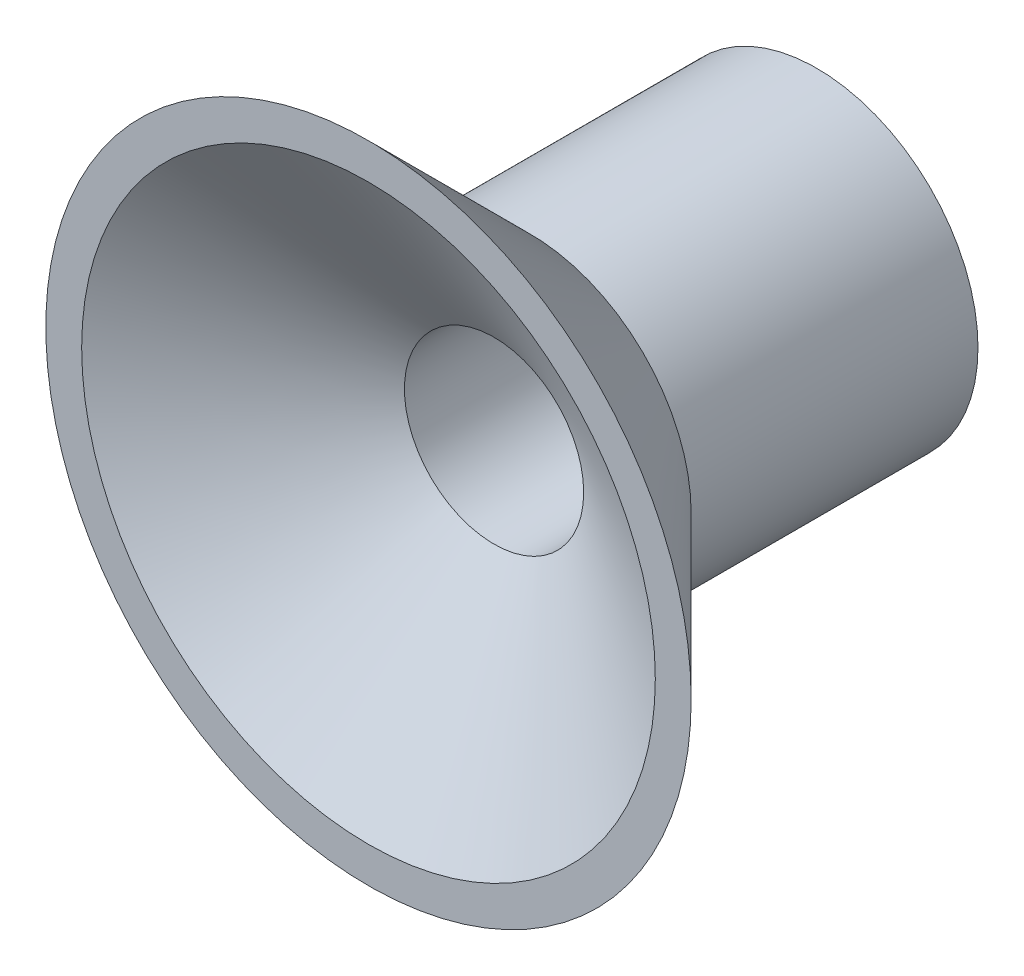
from build123d import *


with BuildPart() as part:
    # 草图1 → 旋转1 (revolve)
    with BuildSketch(Plane(origin=(0, 0, 0), x_dir=(1, 0, 0), z_dir=(0, 1, 0))):
        Polygon((-2.5, 12.5), (-2.5, 3.502347336), (-8, 0), (-9, 0), (-4.5, 4.5), (-4.5, 12.5), align=None)
    revolve(axis=Axis((0, 0, 0), (0, 0, -1)))


solid = part.part
